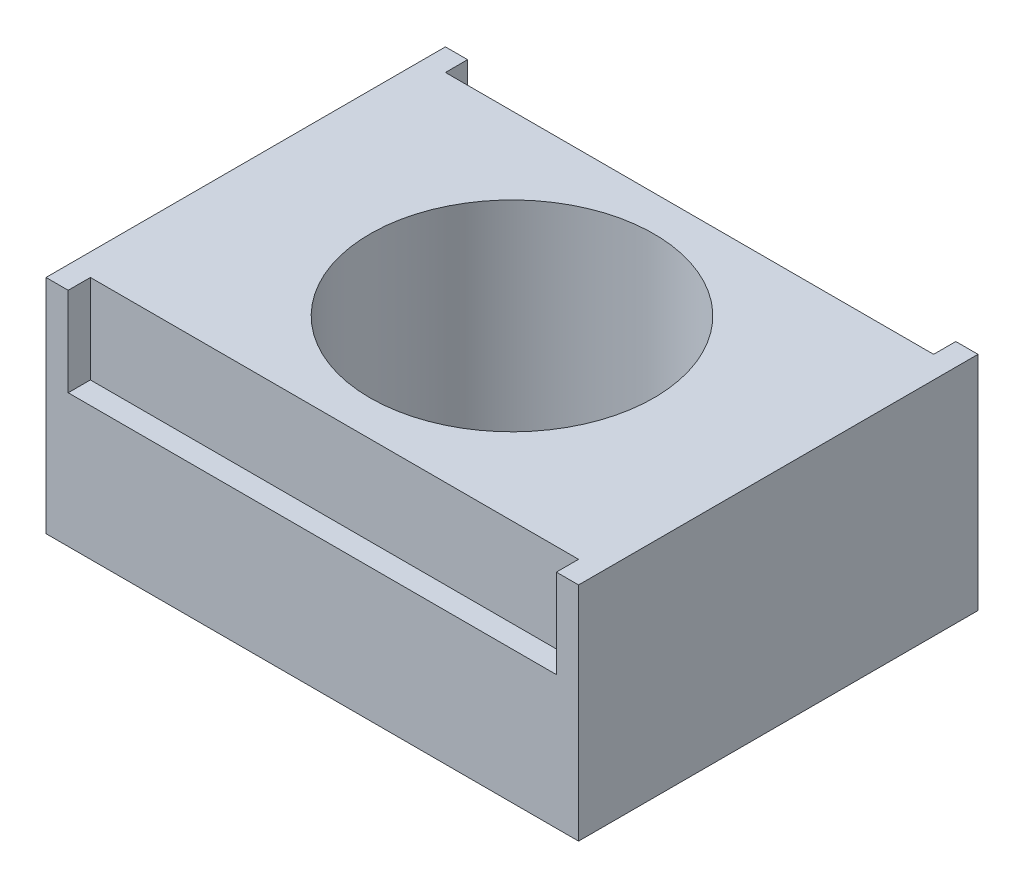
from build123d import *

# Parameters (mm, degrees)
SKETCH1_W           = 24
SKETCH1_H           = 18
SKETCH1_R           = 6.4
BOSS_EXTRUDE1_DEPTH = 10
SKETCH2_W           = 22
SKETCH2_H           = 1
CUT_EXTRUDE1_DEPTH  = 4
SHELL1_DEPTH        = 8.9
SHELL1_2_DEPTH      = 4.9


# Read off the part's stored shape, not the designer's step: Shell1
with BuildPart() as part:
    # Sketch1 → Boss-Extrude1 (new body)
    with BuildSketch(Plane(origin=(0, 0, 0), x_dir=(1, 0, 0), z_dir=(0, 1, 0))):
        Rectangle(SKETCH1_W, SKETCH1_H)
        with Locations(Location((0, 0, 0), (0, 0, 270))):
            Circle(SKETCH1_R, mode=Mode.SUBTRACT)
    extrude(amount=BOSS_EXTRUDE1_DEPTH)

    # Sketch2 → Cut-Extrude1 (cut)
    with BuildSketch(Plane(origin=(0, 10, 0), x_dir=(1, 0, 0), z_dir=(0, 1, 0))):
        with Locations((0, 8.5)):
            Rectangle(SKETCH2_W, SKETCH2_H)
        with Locations((0, -8.5)):
            Rectangle(SKETCH2_W, SKETCH2_H)
    extrude(amount=-CUT_EXTRUDE1_DEPTH, mode=Mode.SUBTRACT)

    # Shell1 outline → Shell1 (cut)
    with BuildSketch(Plane(origin=(0, 0, 0), x_dir=(1, 0, 0), z_dir=(0, 1, 0))):
        with BuildLine():
            ThreePointArc((2.939387691, 6.9), (7.5, 0), (2.939387691, -6.9))
            Line((2.939387691, -6.9), (10.9, -6.9))
            Line((10.9, -6.9), (10.9, 6.9))
            Line((10.9, 6.9), (2.939387691, 6.9))
        make_face()
        with BuildLine():
            ThreePointArc((-2.939387691, -6.9), (-7.5, 0), (-2.939387691, 6.9))
            Line((-2.939387691, 6.9), (-10.9, 6.9))
            Line((-10.9, 6.9), (-10.9, -6.9))
            Line((-10.9, -6.9), (-2.939387691, -6.9))
        make_face()
    extrude(amount=SHELL1_DEPTH, mode=Mode.SUBTRACT)

    # Shell1 2 outline → Shell1 2 (cut)
    with BuildSketch(Plane(origin=(0, 0, 0), x_dir=(1, 0, 0), z_dir=(0, 1, 0))):
        with BuildLine():
            ThreePointArc((-2.939387691, 6.9), (0, 7.5), (2.939387691, 6.9))
            Line((2.939387691, 6.9), (10.9, 6.9))
            Line((10.9, 6.9), (10.9, 7.9))
            Line((10.9, 7.9), (-10.9, 7.9))
            Line((-10.9, 7.9), (-10.9, 6.9))
            Line((-10.9, 6.9), (-2.939387691, 6.9))
        make_face()
        with BuildLine():
            Line((10.9, -6.9), (2.939387691, -6.9))
            ThreePointArc((2.939387691, -6.9), (0, -7.5), (-2.939387691, -6.9))
            Line((-2.939387691, -6.9), (-10.9, -6.9))
            Line((-10.9, -6.9), (-10.9, -7.9))
            Line((-10.9, -7.9), (10.9, -7.9))
            Line((10.9, -7.9), (10.9, -6.9))
        make_face()
    extrude(amount=SHELL1_2_DEPTH, mode=Mode.SUBTRACT)


solid = part.part
